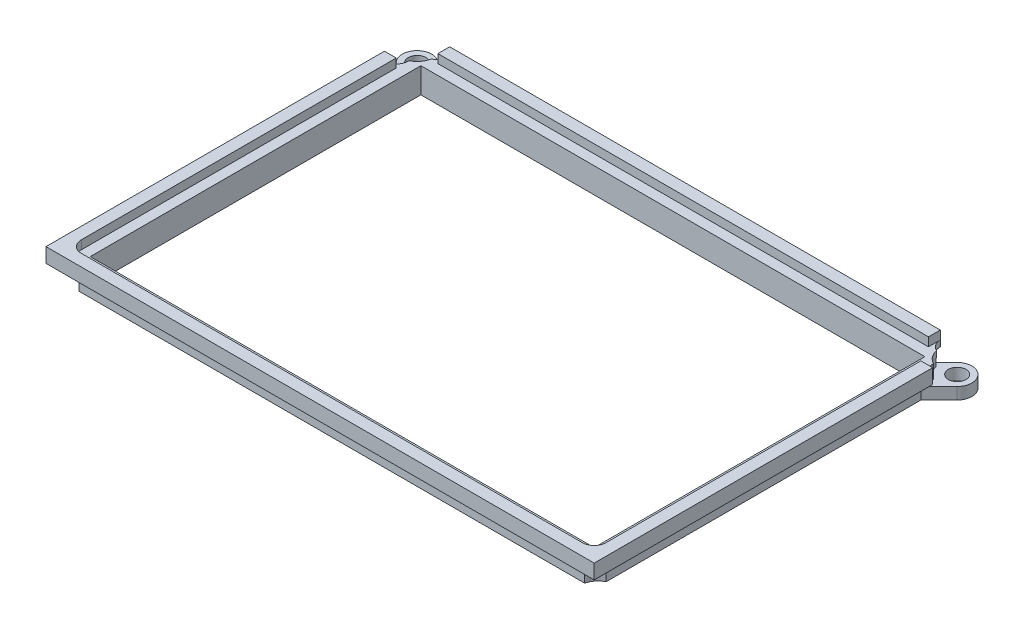
from build123d import *

# Parameters (mm, degrees)
SKETCH1_W             = 83.263532188
SKETCH1_H             = 2
BOSS_EXTRUDE1_DEPTH   = 2.4732
BOSS_EXTRUDE1_2_DEPTH = 2.4732
SKETCH1_3_W           = 85.5392
SKETCH1_3_H           = 56.126
BOSS_EXTRUDE2_DEPTH   = 1
BOSS_EXTRUDE3_START   = -3.29023885
SKETCH1_4_W           = 85.5392
SKETCH1_4_H           = 56.126
BOSS_EXTRUDE3_DEPTH   = 3.29023885
BOSS_EXTRUDE4_START   = -3.290239
BOSS_EXTRUDE4_DEPTH   = 2
FILLET1_R             = 2
FILLET2_R             = 2
SKETCH2_R             = 3
CUT_EXTRUDE1_DEPTH    = 3
CUT_EXTRUDE2_START    = -2
SKETCH2_3_R           = 3
CUT_EXTRUDE2_DEPTH    = 2.5


with BuildPart() as part:
    # Sketch1 → Boss-Extrude1 (new body)
    with BuildSketch(Plane(origin=(0, 0, 0), x_dir=(1, 0, 0), z_dir=(0, 1, 0))):
        with Locations((0, 30.813)):
            Rectangle(SKETCH1_W, SKETCH1_H)
    extrude(amount=BOSS_EXTRUDE1_DEPTH)



with BuildPart() as body_2:
    # Sketch1 → Boss-Extrude1 2 (new body)
    with BuildSketch(Plane(origin=(0, 0, 0), x_dir=(1, 0, 0), z_dir=(0, 1, 0))):
        Polygon((-44.5196, -29.813), (-44.5196, 25.629766094), (-46.5196, 25.629766094), (-46.5196, -31.813), (46.5196, -31.813), (46.5196, 25.629766094), (44.5196, 25.629766094), (44.5196, -29.813), align=None)
    extrude(amount=BOSS_EXTRUDE1_2_DEPTH)


with BuildPart() as part_1:
    add(part.part)

    add(body_2.part)  # Boss-Extrude2 merges body 2
    # Sketch1<3> → Boss-Extrude2 (add)
    with BuildSketch(Plane(origin=(0, 0, 0), x_dir=(1, 0, 0), z_dir=(0, 1, 0))):
        with BuildLine():
            Line((41.631766094, 29.813), (-41.631766094, 29.813))
            Line((-41.631766094, 29.813), (-43.424920204, 29.813))
            ThreePointArc((-43.424920204, 29.813), (-43.834386894, 28.979884149), (-44.5196, 28.353603069))
            Line((-44.5196, 28.353603069), (-44.5196, 25.629766094))
            Line((-44.5196, 25.629766094), (-44.5196, -29.813))
            Line((-44.5196, -29.813), (44.5196, -29.813))
            Line((44.5196, -29.813), (44.5196, 25.629766094))
            Line((44.5196, 25.629766094), (44.5196, 28.353603069))
            ThreePointArc((44.5196, 28.353603069), (43.834386894, 28.979884149), (43.424920204, 29.813))
            Line((43.424920204, 29.813), (41.631766094, 29.813))
        make_face()
        Rectangle(SKETCH1_3_W, SKETCH1_3_H, mode=Mode.SUBTRACT)
    extrude(amount=BOSS_EXTRUDE2_DEPTH)

    # Sketch1<4> → Boss-Extrude3 (add)
    with BuildSketch(Plane(origin=(0, 0, 0), x_dir=(1, 0, 0), z_dir=(0, 1, 0)).offset(BOSS_EXTRUDE3_START)):
        with BuildLine():
            Line((41.631766094, 29.813), (-41.631766094, 29.813))
            Line((-41.631766094, 29.813), (-43.424920204, 29.813))
            ThreePointArc((-43.424920204, 29.813), (-43.834386894, 28.979884149), (-44.5196, 28.353603069))
            Line((-44.5196, 28.353603069), (-44.5196, 25.629766094))
            Line((-44.5196, 25.629766094), (-44.5196, -29.813))
            Line((-44.5196, -29.813), (44.5196, -29.813))
            Line((44.5196, -29.813), (44.5196, 25.629766094))
            Line((44.5196, 25.629766094), (44.5196, 28.353603069))
            ThreePointArc((44.5196, 28.353603069), (43.834386894, 28.979884149), (43.424920204, 29.813))
            Line((43.424920204, 29.813), (41.631766094, 29.813))
        make_face()
        Rectangle(SKETCH1_4_W, SKETCH1_4_H, mode=Mode.SUBTRACT)
    extrude(amount=BOSS_EXTRUDE3_DEPTH)

    # Sketch1<5> → Boss-Extrude4 (add)
    with BuildSketch(Plane(origin=(0, 0, 0), x_dir=(1, 0, 0), z_dir=(0, 1, 0)).offset(BOSS_EXTRUDE4_START)):
        with BuildLine():
            ThreePointArc((-43.3343, 30.48), (-43.524601169, 31.436708581), (-44.066533047, 32.247766953))
            ThreePointArc((-44.066533047, 32.247766953), (-47.602066953, 32.247766953), (-47.602066953, 28.712233047))
            ThreePointArc((-47.602066953, 28.712233047), (-46.123213969, 27.996750371), (-44.5196, 28.353603069))
            Line((-44.5196, 28.353603069), (-44.5196, 29.757806183))
            ThreePointArc((-44.5196, 29.757806183), (-47.287236681, 30.852793509), (-44.3343, 30.48))
            ThreePointArc((-44.3343, 30.48), (-44.373937666, 30.137448026), (-44.490755806, 29.813))
            Line((-44.490755806, 29.813), (-43.424920204, 29.813))
            ThreePointArc((-43.424920204, 29.813), (-43.357058642, 30.143436105), (-43.3343, 30.48))
        make_face()
        with BuildLine():
            ThreePointArc((-44.5196, 28.353603069), (-43.834386894, 28.979884149), (-43.424920204, 29.813))
            Line((-43.424920204, 29.813), (-44.490755806, 29.813))
            ThreePointArc((-44.490755806, 29.813), (-44.504891433, 29.785253383), (-44.5196, 29.757806183))
            Line((-44.5196, 29.757806183), (-44.5196, 28.353603069))
        make_face()
        with BuildLine():
            ThreePointArc((-44.5196, 28.353603069), (-46.123213969, 27.996750371), (-47.602066953, 28.712233047))
            Line((-47.602066953, 28.712233047), (-44.5196, 25.629766094))
            Line((-44.5196, 25.629766094), (-44.5196, 28.353603069))
        make_face()
        with BuildLine():
            Line((-41.631766094, 29.813), (-44.066533047, 32.247766953))
            ThreePointArc((-44.066533047, 32.247766953), (-43.524601169, 31.436708581), (-43.3343, 30.48))
            ThreePointArc((-43.3343, 30.48), (-43.357058642, 30.143436105), (-43.424920204, 29.813))
            Line((-43.424920204, 29.813), (-41.631766094, 29.813))
        make_face()
        with BuildLine():
            ThreePointArc((44.066533047, 32.247766953), (43.416829986, 31.117054732), (43.424920204, 29.813))
            Line((43.424920204, 29.813), (44.490755806, 29.813))
            ThreePointArc((44.490755806, 29.813), (45.491748026, 31.940362334), (47.3343, 30.48))
            ThreePointArc((47.3343, 30.48), (46.207093509, 29.027063319), (44.5196, 29.757806183))
            Line((44.5196, 29.757806183), (44.5196, 28.353603069))
            ThreePointArc((44.5196, 28.353603069), (46.123213969, 27.996750371), (47.602066953, 28.712233047))
            ThreePointArc((47.602066953, 28.712233047), (48.143998831, 29.523291419), (48.3343, 30.48))
            ThreePointArc((48.3343, 30.48), (46.791008581, 32.789698831), (44.066533047, 32.247766953))
        make_face()
        with BuildLine():
            Line((44.490755806, 29.813), (43.424920204, 29.813))
            ThreePointArc((43.424920204, 29.813), (43.834386894, 28.979884149), (44.5196, 28.353603069))
            Line((44.5196, 28.353603069), (44.5196, 29.757806183))
            ThreePointArc((44.5196, 29.757806183), (44.504891433, 29.785253383), (44.490755806, 29.813))
        make_face()
        with BuildLine():
            Line((44.066533047, 32.247766953), (41.631766094, 29.813))
            Line((41.631766094, 29.813), (43.424920204, 29.813))
            ThreePointArc((43.424920204, 29.813), (43.416829986, 31.117054732), (44.066533047, 32.247766953))
        make_face()
        with BuildLine():
            ThreePointArc((47.602066953, 28.712233047), (46.123213969, 27.996750371), (44.5196, 28.353603069))
            Line((44.5196, 28.353603069), (44.5196, 25.629766094))
            Line((44.5196, 25.629766094), (47.602066953, 28.712233047))
        make_face()
    extrude(amount=BOSS_EXTRUDE4_DEPTH)

    # Fillet1
    # the kernel refuses this fillet: 2 mm, written as the material it adds along each edge
    with BuildSketch(Plane(origin=(44.5196, 0, -25.629766094), x_dir=(0, 0, -1), z_dir=(0, 1, 0))) as fillet1_piece_1:
        with BuildLine():
            CenterArc((FILLET1_R, -FILLET1_R), FILLET1_R, 90, 90)
            Line((0, -FILLET1_R), (0, 0))
            Line((0, 0), (FILLET1_R, 0))
        make_face()
    extrude(amount=1)
    with BuildSketch(Plane(origin=(41.631766094, 0, -29.813), x_dir=(0, 0, -1), z_dir=(0, 1, 0))) as fillet1_piece_2:
        with BuildLine():
            CenterArc((1.989274938, -2), FILLET1_R, 90, 84.063686733)
            Line((0, -1.79315411), (0, 0))
            Line((0, 0), (1.989274938, 0))
        make_face()
    extrude(amount=1)
    with BuildSketch(Plane(origin=(-41.631766094, 0, -29.813), x_dir=(-1, 0, 0), z_dir=(0, 1, 0))) as fillet1_piece_3:
        with BuildLine():
            CenterArc((2, -1.989274938), FILLET1_R, 95.936313267, 84.063686733)
            Line((0, -1.989274938), (0, 0))
            Line((0, 0), (1.79315411, 0))
        make_face()
    extrude(amount=1)
    with BuildSketch(Plane(origin=(-44.5196, 0, -25.629766094), x_dir=(0, 0, -1), z_dir=(0, 1, 0))) as fillet1_piece_4:
        with BuildLine():
            CenterArc((FILLET1_R, FILLET1_R), FILLET1_R, 180, 90)
            Line((0, FILLET1_R), (0, 0))
            Line((0, 0), (FILLET1_R, 0))
        make_face()
    extrude(amount=1)

    # Fillet2
    fillet2_edges = [part_1.edges().sort_by_distance(p)[0] for p in [
        (-44.5196, 1.7366, 29.813),
        (44.5196, 1.7366, 29.813),
    ]]
    fillet(fillet2_edges, radius=FILLET2_R)

    # Sketch2 → Cut-Extrude1 (cut)
    with BuildSketch(Plane(origin=(0, -1.29023885, 0), x_dir=(1, 0, 0), z_dir=(0, 1, 0))):
        with Locations((-45.8343, 30.48)):
            Circle(SKETCH2_R)
        with Locations((45.8343, 30.48)):
            Circle(SKETCH2_R)
    extrude(amount=CUT_EXTRUDE1_DEPTH, mode=Mode.SUBTRACT)

    # Sketch2<3> → Cut-Extrude2 (cut)
    with BuildSketch(Plane(origin=(0, -1.29023885, 0), x_dir=(1, 0, 0), z_dir=(0, 1, 0)).offset(CUT_EXTRUDE2_START)):
        with Locations((-45.8343, -30.48)):
            Circle(SKETCH2_3_R)
        with Locations((45.8343, -30.48)):
            Circle(SKETCH2_3_R)
    extrude(amount=CUT_EXTRUDE2_DEPTH, mode=Mode.SUBTRACT)


solid = part_1.part
